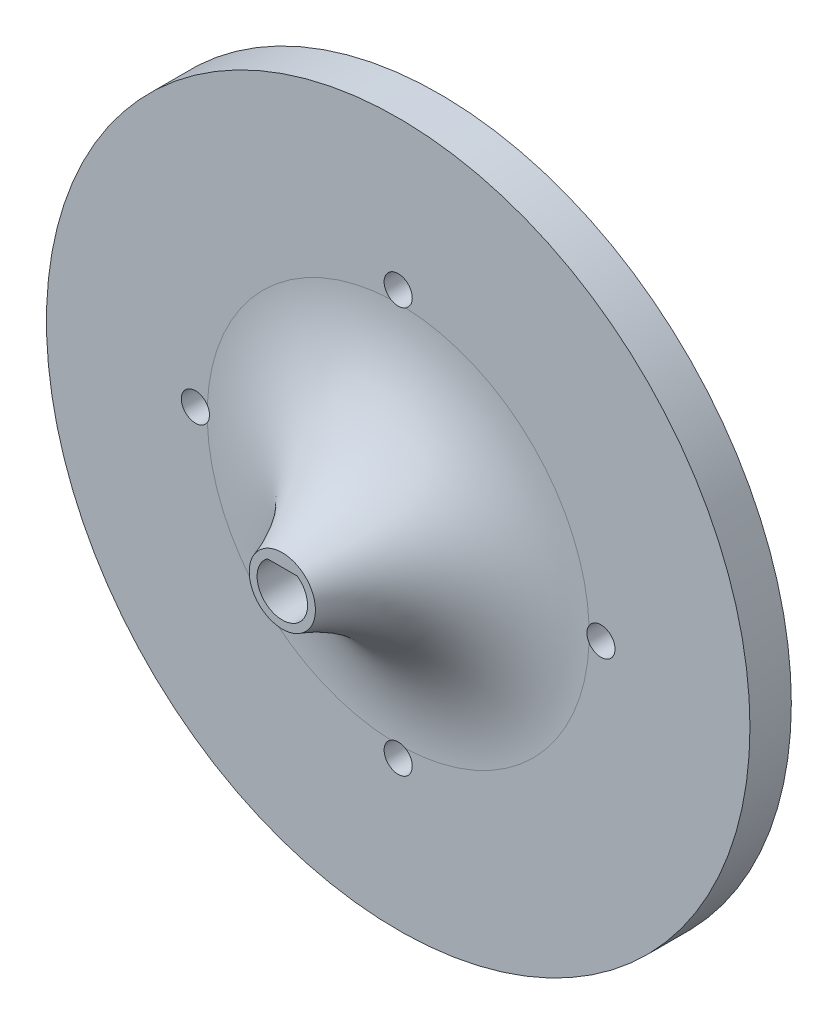
from build123d import *

# Parameters (mm, degrees)
BOSS_EXTRUDE2_DEPTH = 5
SKETCH5_R           = 4
BOSS_EXTRUDE3_DEPTH = 7
SKETCH6_R           = 15.5
CUT_EXTRUDE1_DEPTH  = 4
SKETCH7_R           = 1.8
CUT_EXTRUDE2_DEPTH  = 4
CUT_EXTRUDE3_DEPTH  = 6
CUT_EXTRUDE4_DEPTH  = 7
SKETCH11_R          = 4
BOSS_EXTRUDE4_DEPTH = 7
SKETCH12_R          = 42.5
BOSS_EXTRUDE5_DEPTH = 5
SKETCH13_R          = 45.773900861
SKETCH13_R_2        = 42.5
CUT_EXTRUDE5_DEPTH  = 5
SKETCH14_R          = 16
CUT_EXTRUDE6_DEPTH  = 2.5
SKETCH15_R          = 1.7
CUT_EXTRUDE7_DEPTH  = 2.5
CUT_EXTRUDE8_START  = -14
CUT_EXTRUDE8_DEPTH  = 14
FILLET1_R           = 20


with BuildPart() as part:
    # Sketch4 → Boss-Extrude2 (new body)
    with BuildSketch(Plane.XY):
        with BuildLine():
            Line((-17, 0), (-17, 34))
            Line((-17, 34), (17, 34))
            Line((17, 34), (17, 0))
            ThreePointArc((17, 0), (0, -17), (-17, 0))
        make_face()
    extrude(amount=BOSS_EXTRUDE2_DEPTH)

    # Sketch5 → Boss-Extrude3 (add)
    with BuildSketch(Plane.XY.offset(5)):
        with Locations(Location((0, -8.5, 0), (0, 0, 180))):
            Circle(SKETCH5_R)
    extrude(amount=BOSS_EXTRUDE3_DEPTH)

    # Sketch6 → Cut-Extrude1 (cut)
    with BuildSketch(Plane(origin=(0, 0, 0), x_dir=(-1, 0, 0), z_dir=(0, 0, -1))):
        with Locations((0, 17.71586122)):
            Circle(SKETCH6_R)
    extrude(amount=-CUT_EXTRUDE1_DEPTH, mode=Mode.SUBTRACT)

    # Sketch7 → Cut-Extrude2 (cut)
    with BuildSketch(Plane(origin=(0, 0, 4), x_dir=(-1, 0, 0), z_dir=(0, 0, -1))):
        with Locations((0, 17.71586122)):
            Circle(SKETCH7_R)
    extrude(amount=-CUT_EXTRUDE2_DEPTH, mode=Mode.SUBTRACT)

    # Sketch8 → Cut-Extrude3 (cut)
    with BuildSketch(Plane.XY.offset(12)):
        with BuildLine():
            Line((-1.405880507, -7.12), (1.405880507, -7.12))
            ThreePointArc((1.405880507, -7.12), (0, -10.47), (-1.405880507, -7.12))
        make_face()
    extrude(amount=-CUT_EXTRUDE3_DEPTH, mode=Mode.SUBTRACT)

    # Sketch10 → Cut-Extrude4 (cut)
    with BuildSketch(Plane.XY.offset(12)):
        with BuildLine():
            Line((1.439062195, -7.04), (-1.439062195, -7.04))
            ThreePointArc((-1.439062195, -7.04), (0, -10.55), (1.439062195, -7.04))
        make_face()
    extrude(amount=-CUT_EXTRUDE4_DEPTH, mode=Mode.SUBTRACT)

    # Sketch11 → Boss-Extrude4 (add)
    with BuildSketch(Plane.XY.offset(12)):
        with Locations(Location((0, -8.5, 0), (0, 0, 180))):
            Circle(SKETCH11_R)
        with BuildLine():
            Line((1.439062195, -7.04), (-1.439062195, -7.04))
            ThreePointArc((-1.439062195, -7.04), (0, -10.55), (1.439062195, -7.04))
        make_face(mode=Mode.SUBTRACT)
    extrude(amount=BOSS_EXTRUDE4_DEPTH)

    # Sketch12 → Boss-Extrude5 (add)
    with BuildSketch(Plane.XY.offset(5)):
        with Locations((0, -8.5)):
            Circle(SKETCH12_R)
    extrude(amount=-BOSS_EXTRUDE5_DEPTH)

    # Sketch13 → Cut-Extrude5 (cut)
    with BuildSketch(Plane.XY.offset(5)):
        with Locations((0, -8.5)):
            Circle(SKETCH13_R)
        with Locations((0, -8.5)):
            Circle(SKETCH13_R_2, mode=Mode.SUBTRACT)
    extrude(amount=-CUT_EXTRUDE5_DEPTH, mode=Mode.SUBTRACT)

    # Sketch14 → Cut-Extrude6 (cut)
    with BuildSketch(Plane(origin=(0, 0, 0), x_dir=(-1, 0, 0), z_dir=(0, 0, -1))):
        with Locations((0, 16)):
            Circle(SKETCH14_R)
        with Locations(Location((0, -33, 0), (0, 0, 180))):
            Circle(SKETCH14_R)
        with Locations((-24.5, -8.5)):
            Circle(SKETCH14_R)
        with Locations(Location((24.5, -8.5, 0), (0, 0, 180))):
            Circle(SKETCH14_R)
    extrude(amount=-CUT_EXTRUDE6_DEPTH, mode=Mode.SUBTRACT)

    # Sketch15 → Cut-Extrude7 (cut)
    with BuildSketch(Plane(origin=(0, 0, 2.5), x_dir=(-1, 0, 0), z_dir=(0, 0, -1))):
        with Locations((0, 16)):
            Circle(SKETCH15_R)
        with Locations((-24.5, -8.5)):
            Circle(SKETCH15_R)
        with Locations((24.5, -8.5)):
            Circle(SKETCH15_R)
        with Locations((0, -33)):
            Circle(SKETCH15_R)
    extrude(amount=-CUT_EXTRUDE7_DEPTH, mode=Mode.SUBTRACT)

    # Sketch16 → Cut-Extrude8 (cut)
    with BuildSketch(Plane.XY.offset(19).offset(CUT_EXTRUDE8_START)):
        with BuildLine():
            Line((1.803025236, -6.04), (-1.803025236, -6.04))
            ThreePointArc((-1.803025236, -6.04), (0, -11.55), (1.803025236, -6.04))
        make_face()
        with BuildLine():
            Line((1.439062195, -7.04), (-1.439062195, -7.04))
            ThreePointArc((-1.439062195, -7.04), (0, -10.55), (1.439062195, -7.04))
        make_face(mode=Mode.SUBTRACT)
    extrude(amount=CUT_EXTRUDE8_DEPTH, mode=Mode.SUBTRACT)

    # Fillet1
    # the kernel refuses this fillet: 20 mm, written as the material it adds along each edge
    with BuildSketch(Plane(origin=(0, -8.5, 5), x_dir=(-1, 0, 0), z_dir=(0, 1, 0))) as fillet1_piece_1_section:
        with BuildLine():
            CenterArc((23.078784028, 20), FILLET1_R, 197.457603124, 72.542396876)
            Line((4, 14), (3.618424319, 13.88))
            ThreePointArc((3.618424319, 13.88), (3.6, 7), (3.6, 0))
            Line((3.6, 0), (4, -0.4))
            Line((4, -0.4), (23.078784028, -0.4))
            Line((23.078784028, -0.4), (23.078784028, 0))
        make_face()
    fillet1_piece_1 = revolve(axis=Axis((0, -8.5, 5), (0, 0, 1)), mode=Mode.PRIVATE)
    fillet1_piece_1 = fillet1_piece_1 - Plane(origin=(0, -33, 8.742108551), x_dir=(-1, 0, 0), z_dir=(0, 0, -1)) * Cylinder(1.7, 93, mode=Mode.PRIVATE)
    fillet1_piece_1 = fillet1_piece_1 - Plane(origin=(-24.5, -8.5, 8.742108551), x_dir=(-1, 0, 0), z_dir=(0, 0, -1)) * Cylinder(1.7, 93, mode=Mode.PRIVATE)
    fillet1_piece_1 = fillet1_piece_1 - Plane(origin=(0, 16, 8.742108551), x_dir=(-1, 0, 0), z_dir=(0, 0, -1)) * Cylinder(1.7, 93, mode=Mode.PRIVATE)
    fillet1_piece_1 = fillet1_piece_1 - Plane(origin=(24.5, -8.5, 8.742108551), x_dir=(-1, 0, 0), z_dir=(0, 0, -1)) * Cylinder(1.7, 93, mode=Mode.PRIVATE)
    add(fillet1_piece_1)


solid = part.part
